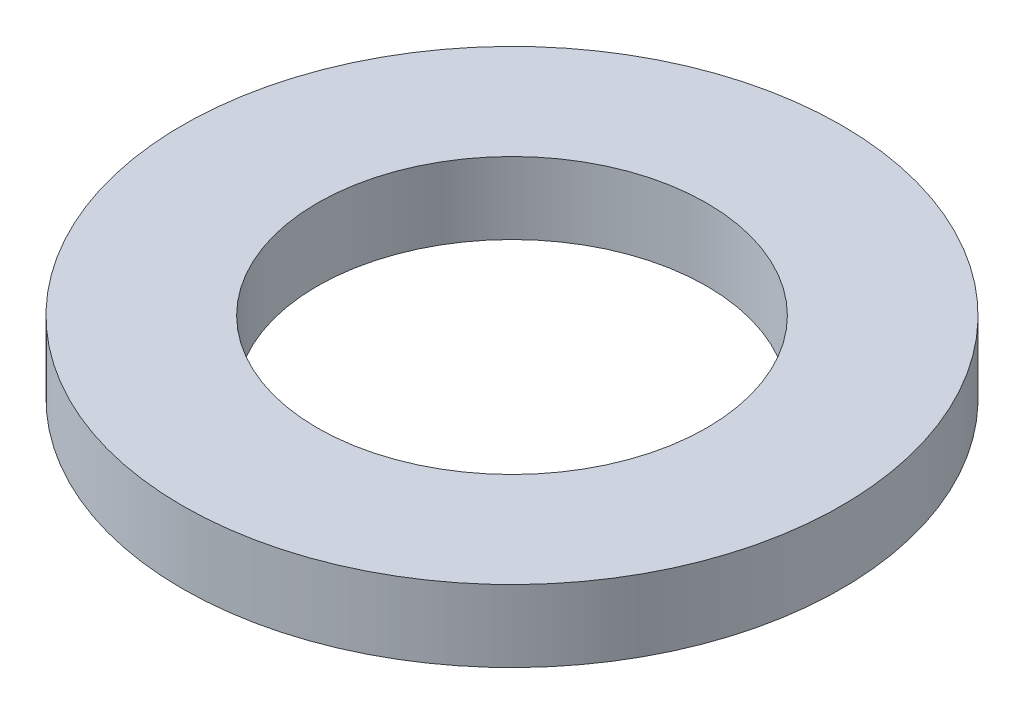
from build123d import *

# Parameters (mm, degrees)
SKETCH1_R           = 55
BOSS_EXTRUDE1_DEPTH = 12
SKETCH2_R           = 32.5
CUT_EXTRUDE1_DEPTH  = 79.70196948


with BuildPart() as part:
    # Sketch1 → Boss-Extrude1 (new body)
    with BuildSketch(Plane(origin=(0, 0, 0), x_dir=(1, 0, 0), z_dir=(0, 1, 0))):
        Circle(SKETCH1_R)
    extrude(amount=BOSS_EXTRUDE1_DEPTH)

    # Sketch2 → Cut-Extrude1 (cut, through all)
    with BuildSketch(Plane(origin=(0, 0, 0), x_dir=(1, 0, 0), z_dir=(0, 1, 0))):
        Circle(SKETCH2_R)
    extrude(amount=CUT_EXTRUDE1_DEPTH, mode=Mode.SUBTRACT)


solid = part.part
